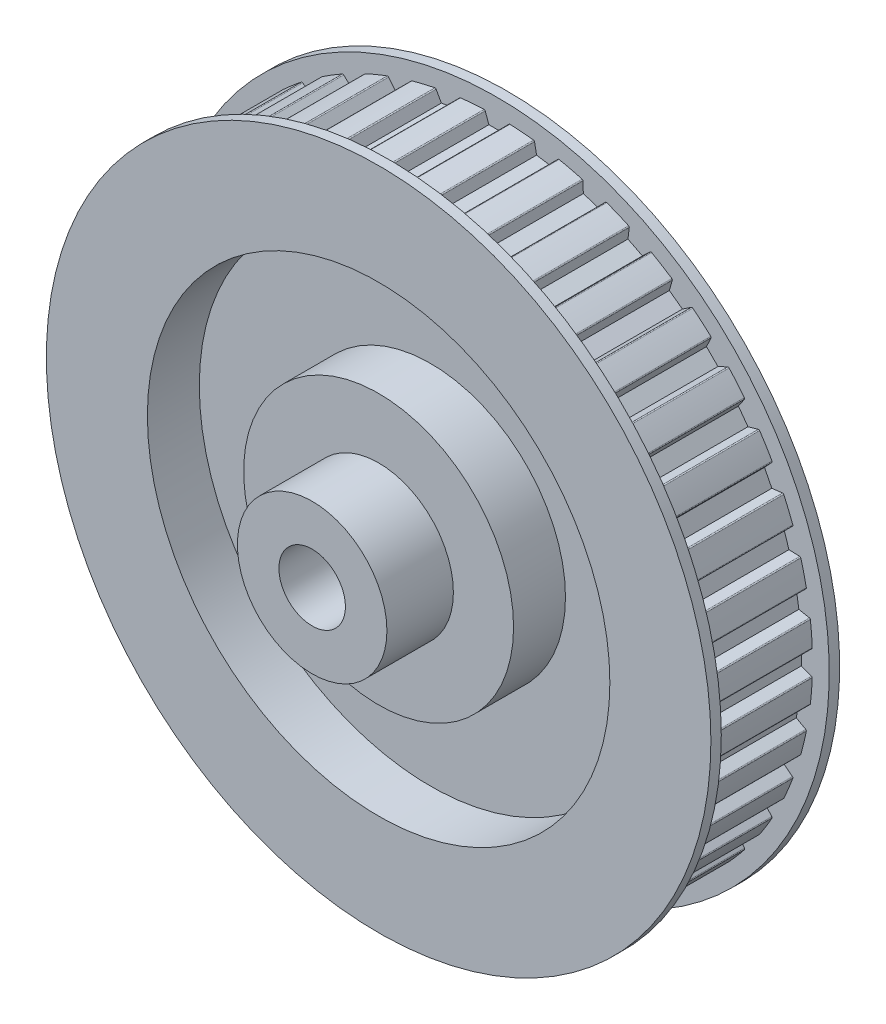
from build123d import *

# Parameters (mm, degrees)
SKETCH1_W           = 63.5
SKETCH1_H           = 1.984375
BOSS_EXTRUDE1_DEPTH = 20.6375
BOSS_EXTRUDE2_START = -1.984375
SKETCH3_R           = 63.5
BOSS_EXTRUDE2_DEPTH = 1.984375
HOLE1_D             = 88.382475
HOLE1_DEPTH         = 9.921875
HOLE2_D             = 88.382475
HOLE2_DEPTH         = 9.921875
SKETCH8_W           = 14.2875
SKETCH8_H           = 9.921875
HOLE3_D             = 12.7127
FILLET1_R           = 0.2286
CUT_EXTRUDE1_DEPTH  = 20.6502
CIRPATTERN2_COUNT   = 40


with BuildPart() as part:
    # Sketch1 → Revolve1 (revolve)
    with BuildSketch(Plane(origin=(0, 0, 0), x_dir=(1, 0, 0), z_dir=(0, 1, 0))):
        with Locations((31.75, -11.3109375)):
            Rectangle(SKETCH1_W, SKETCH1_H)
    revolve(axis=Axis((0, 0, 10.31875), (0, 0, 1)))

    # Sketch2 → Boss-Extrude1 (add)
    with BuildSketch(Plane(origin=(0, 0, 10.31875), x_dir=(-1, 0, 0), z_dir=(0, 0, -1))):
        with BuildLine():
            Line((20.814765597, -56.586407632), (19.445887203, -54.834323187))
            Line((19.445887203, -54.834323187), (16.498753271, -55.791905049))
            Line((16.498753271, -55.791905049), (16.421156785, -58.013977673))
            ThreePointArc((16.421156785, -58.013977673), (-4.730553873, -60.107386032), (-25.294370657, -54.730894462))
            Line((-25.294370657, -54.730894462), (-25.02340306, -52.524040475))
            Line((-25.02340306, -52.524040475), (-27.784454077, -51.117214714))
            Line((-27.784454077, -51.117214714), (-29.410565699, -52.633588333))
            ThreePointArc((-29.410565699, -52.633588333), (-42.633765935, -42.633765935), (-52.633588333, -29.410565699))
            Line((-52.633588333, -29.410565699), (-51.117214714, -27.784454077))
            Line((-51.117214714, -27.784454077), (-52.524040475, -25.02340306))
            Line((-52.524040475, -25.02340306), (-54.730894462, -25.294370657))
            ThreePointArc((-54.730894462, -25.294370657), (-60.107386032, -4.730553873), (-58.013977673, 16.421156785))
            Line((-58.013977673, 16.421156785), (-55.791905049, 16.498753271))
            Line((-55.791905049, 16.498753271), (-54.834323187, 19.445887203))
            Line((-54.834323187, 19.445887203), (-56.586407632, 20.814765597))
            ThreePointArc((-56.586407632, 20.814765597), (-48.778263896, 35.439483163), (-37.282180065, 47.384755409))
            Line((-37.282180065, 47.384755409), (-35.43887548, 46.141430767))
            Line((-35.43887548, 46.141430767), (-32.931893617, 47.962859707))
            Line((-32.931893617, 47.962859707), (-33.544753177, 50.100154988))
            ThreePointArc((-33.544753177, 50.100154988), (-14.075179684, 58.627342703), (7.143599533, 59.868564216))
            Line((7.143599533, 59.868564216), (7.56784942, 57.685987758))
            Line((7.56784942, 57.685987758), (10.62849805, 57.201228638))
            Line((10.62849805, 57.201228638), (11.706436886, 59.145881776))
            ThreePointArc((11.706436886, 59.145881776), (27.372562698, 53.721679115), (40.969152545, 44.235783426))
            Line((40.969152545, 44.235783426), (40.02949166, 42.220674153))
            Line((40.02949166, 42.220674153), (42.220674153, 40.02949166))
            Line((42.220674153, 40.02949166), (44.235783426, 40.969152545))
            ThreePointArc((44.235783426, 40.969152545), (53.721679115, 27.372562698), (59.145881776, 11.706436886))
            Line((59.145881776, 11.706436886), (57.201228638, 10.62849805))
            Line((57.201228638, 10.62849805), (57.685987758, 7.56784942))
            Line((57.685987758, 7.56784942), (59.868564216, 7.143599533))
            ThreePointArc((59.868564216, 7.143599533), (58.627342703, -14.075179684), (50.100154988, -33.544753177))
            Line((50.100154988, -33.544753177), (47.962859707, -32.931893617))
            Line((47.962859707, -32.931893617), (46.141430767, -35.43887548))
            Line((46.141430767, -35.43887548), (47.384755409, -37.282180065))
            ThreePointArc((47.384755409, -37.282180065), (35.439483163, -48.778263896), (20.814765597, -56.586407632))
        make_face()
    extrude(amount=BOSS_EXTRUDE1_DEPTH)

    # Sketch3 → Boss-Extrude2 (add)
    with BuildSketch(Plane.XY.offset(-10.31875).offset(BOSS_EXTRUDE2_START)):
        Circle(SKETCH3_R)
    extrude(amount=BOSS_EXTRUDE2_DEPTH)

    # Hole1
    with Locations(Plane(origin=(0, 0, -12.303125), x_dir=(-1, 0, 0), z_dir=(0, 0, -1))):
        with Locations((0, 0)):
            Hole(HOLE1_D / 2, depth=HOLE1_DEPTH)

    # Hole2
    with Locations(Plane.XY.offset(12.303125)):
        with Locations((0, 0)):
            Hole(HOLE2_D / 2, depth=HOLE2_DEPTH)

    # Sketch8 → Revolve2 (revolve)
    with BuildSketch(Plane(origin=(0, 0, 0), x_dir=(1, 0, 0), z_dir=(0, 1, 0))):
        with Locations((7.14375, 7.3421875)):
            Rectangle(SKETCH8_W, SKETCH8_H)
    revolve(axis=Axis((0, 0, -12.303125), (0, 0, 1)))

    # Sketch9 → Revolve3 (revolve)
    with BuildSketch(Plane(origin=(0, 0, 0), x_dir=(1, 0, 0), z_dir=(0, 1, 0))):
        Polygon((25.7889375, -2.38125), (0, -2.38125), (0, -25.003125), (14.2875, -25.003125), (14.2875, -12.303125), (25.7889375, -12.303125), align=None)
    revolve(axis=Axis((0, 0, 2.38125), (0, 0, 1)))

    # Hole3 (through all)
    with Locations(Plane.XY.offset(25.003125)):
        with Locations((0, 0)):
            Hole(HOLE3_D / 2)

    # Fillet1
    fillet1_edges = [part.edges().sort_by_distance(p)[0] for p in [
        (-7.143599533, 59.868564216, 0),
        (58.013977673, 16.421156785, 0),
        (52.633588333, -29.410565699, 0),
        (-59.145881776, 11.706436886, 0),
        (37.282180065, 47.384755409, 0),
        (-59.868564216, 7.143599533, 0),
        (-44.235783426, 40.969152545, 0),
        (-50.100154988, -33.544753177, 0),
        (54.730894462, -25.294370657, 0),
        (-47.384755409, -37.282180065, 0),
        (56.586407632, 20.814765597, 0),
        (-20.814765597, -56.586407632, 0),
        (33.544753177, 50.100154988, 0),
        (-16.421156785, -58.013977673, 0),
        (-11.706436886, 59.145881776, 0),
        (25.294370657, -54.730894462, 0),
        (-40.969152545, 44.235783426, 0),
        (29.410565699, -52.633588333, 0),
    ]]
    fillet(fillet1_edges, radius=FILLET1_R)

    # Sketch12 → Cut-Extrude1 (cut)
    with BuildSketch(Plane.XY.offset(-10.31875)):
        with BuildLine():
            Line((35.43887548, 46.141430767), (37.143791211, 47.291410948))
            ThreePointArc((37.143791211, 47.291410948), (37.280307439, 47.330327929), (37.413474745, 47.281158013))
            ThreePointArc((37.413474745, 47.281158013), (35.439530543, 48.778329109), (33.405653911, 50.193010293))
            ThreePointArc((33.405653911, 50.193010293), (33.493568241, 50.081554999), (33.498741827, 49.939694342))
            Line((33.498741827, 49.939694342), (32.931893617, 47.962859707))
            Line((32.931893617, 47.962859707), (35.43887548, 46.141430767))
        make_face()
    cut_extrude1 = extrude(amount=CUT_EXTRUDE1_DEPTH, mode=Mode.SUBTRACT)

    # CirPattern2: Cut-Extrude1 ×40 about axis
    cirpattern2_axis = Axis((0, 0, 12.303125), (0, 0, 1))
    for i in range(1, CIRPATTERN2_COUNT):
        add(cut_extrude1.rotate(cirpattern2_axis, i * 360 / CIRPATTERN2_COUNT), mode=Mode.SUBTRACT)


solid = part.part
